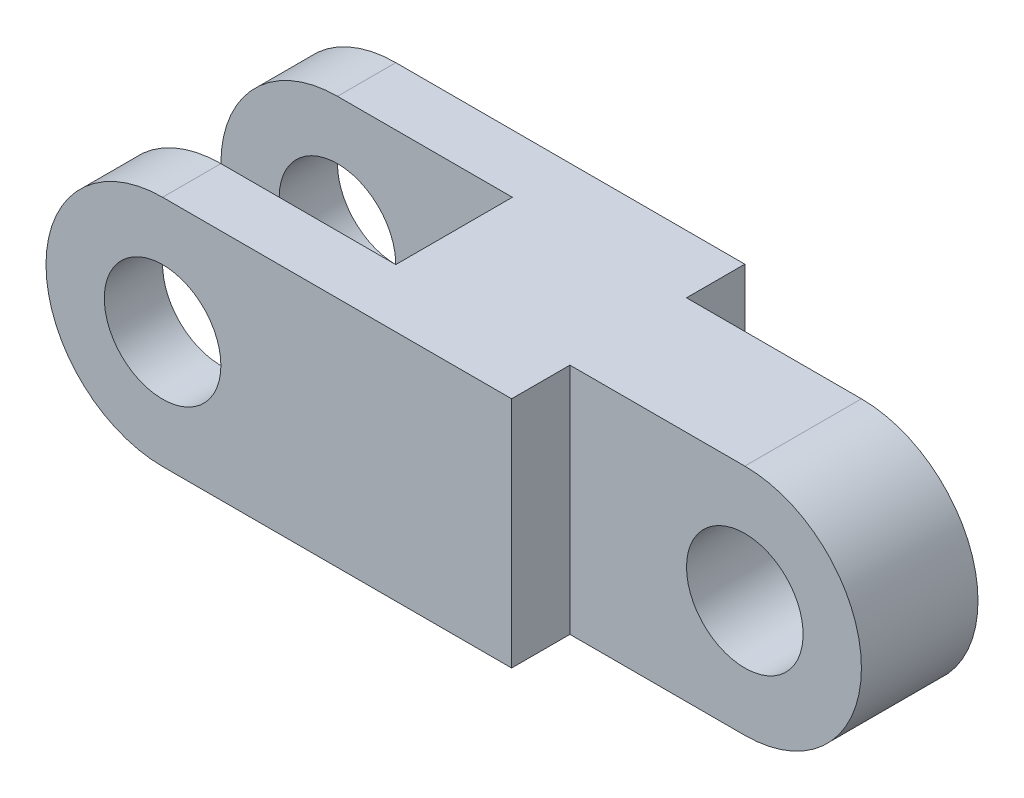
from build123d import *

# Parameters (mm, degrees)
SKETCH1_R           = 5
BOSS_EXTRUDE1_DEPTH = 20
SKETCH2_W           = 25
SKETCH2_H           = 10
SKETCH2_H_2         = 5
CUT_EXTRUDE1_DEPTH  = 62.789458799


with BuildPart() as part:
    # Sketch1 → Boss-Extrude1 (new body)
    with BuildSketch(Plane.XY):
        with BuildLine():
            Line((0, 10), (44.935755376, 10))
            ThreePointArc((44.935755376, 10), (54.935755376, 0), (44.935755376, -10))
            Line((44.935755376, -10), (0, -10))
            ThreePointArc((0, -10), (-10, 0), (0, 10))
        make_face()
        Circle(SKETCH1_R, mode=Mode.SUBTRACT)
        with Locations((44.935755376, 0)):
            Circle(SKETCH1_R, mode=Mode.SUBTRACT)
    extrude(amount=BOSS_EXTRUDE1_DEPTH)

    # Sketch2 → Cut-Extrude1 (cut, through all)
    with BuildSketch(Plane(origin=(0, 10, 0), x_dir=(1, 0, 0), z_dir=(0, 1, 0))):
        with Locations((2.5, -10)):
            Rectangle(SKETCH2_W, SKETCH2_H)
        with Locations((42.435755376, -2.5)):
            Rectangle(SKETCH2_W, SKETCH2_H_2)
        with Locations((42.435755376, -17.5)):
            Rectangle(SKETCH2_W, SKETCH2_H_2)
    extrude(amount=-CUT_EXTRUDE1_DEPTH, mode=Mode.SUBTRACT)


solid = part.part
